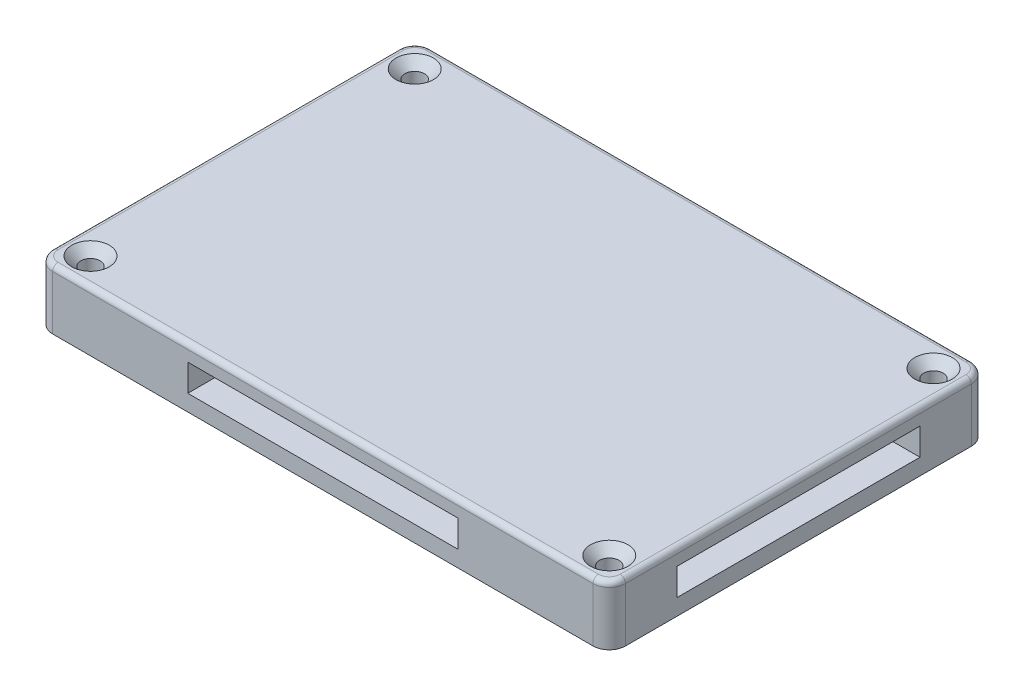
from build123d import *

# Parameters (mm, degrees)
CROQUIS1_W                                           = 106
CROQUIS1_H                                           = 70
SALIENTE_EXTRUIR1_DEPTH                              = 11
CROQUIS2_W                                           = 50
CROQUIS2_H                                           = 5
CORTAR_EXTRUIR1_DEPTH                                = 128.502941143
CROQUIS3_W                                           = 45
CROQUIS3_H                                           = 5
CORTAR_EXTRUIR2_DEPTH                                = 128.502941143
REDONDEO1_R                                          = 3
AVELLANADO_PARA_TORNILLO_CON_CABEZA_AVEL_D           = 3.6
AVELLANADO_PARA_TORNILLO_CON_CABEZA_AVEL_CSINK_D     = 6.94
AVELLANADO_PARA_TORNILLO_CON_CABEZA_AVEL_CSINK_ANGLE = 90
REDONDEO2_R                                          = 1


with BuildPart() as part:
    # Croquis1 → Saliente-Extruir1 (new body)
    with BuildSketch(Plane(origin=(0, 0, 0), x_dir=(1, 0, 0), z_dir=(0, 1, 0))):
        with Locations((53, 35)):
            Rectangle(CROQUIS1_W, CROQUIS1_H)
    extrude(amount=SALIENTE_EXTRUIR1_DEPTH)

    # Croquis2 → Cortar-Extruir1 (cut, through all)
    with BuildSketch(Plane.XY):
        with Locations((53, 5.5)):
            Rectangle(CROQUIS2_W, CROQUIS2_H)
    extrude(amount=-CORTAR_EXTRUIR1_DEPTH, mode=Mode.SUBTRACT)

    # Croquis3 → Cortar-Extruir2 (cut, through all)
    with BuildSketch(Plane(origin=(106, 0, 0), x_dir=(0, 0, -1), z_dir=(1, 0, 0))):
        with Locations((35, 5.5)):
            Rectangle(CROQUIS3_W, CROQUIS3_H)
    extrude(amount=-CORTAR_EXTRUIR2_DEPTH, mode=Mode.SUBTRACT)

    # Redondeo1
    redondeo1_edges = [part.edges().sort_by_distance(p)[0] for p in [
        (0, 5.5, 0),
        (0, 5.5, -70),
        (106, 5.5, -70),
        (106, 5.5, 0),
    ]]
    fillet(redondeo1_edges, radius=REDONDEO1_R)

    # Avellanado para tornillo con cabeza avellanada de clavija hexagonal de M32 (through all)
    with Locations(Plane(origin=(0, 11, 0), x_dir=(1, 0, 0), z_dir=(0, 1, 0))):
        with Locations((5, 65), (101, 65), (101, 5), (5, 5)):
            CounterSinkHole(AVELLANADO_PARA_TORNILLO_CON_CABEZA_AVEL_D / 2, AVELLANADO_PARA_TORNILLO_CON_CABEZA_AVEL_CSINK_D / 2, counter_sink_angle=AVELLANADO_PARA_TORNILLO_CON_CABEZA_AVEL_CSINK_ANGLE)

    # Redondeo2
    redondeo2_edges = [part.edges().sort_by_distance(p)[0] for p in [
        (105.121320344, 11, -0.878679656),
        (53, 11, 0),
        (0.878679656, 11, -0.878679656),
        (0, 11, -35),
        (0.878679656, 11, -69.121320344),
        (53, 11, -70),
        (105.121320344, 11, -69.121320344),
        (106, 11, -35),
    ]]
    fillet(redondeo2_edges, radius=REDONDEO2_R)


solid = part.part
